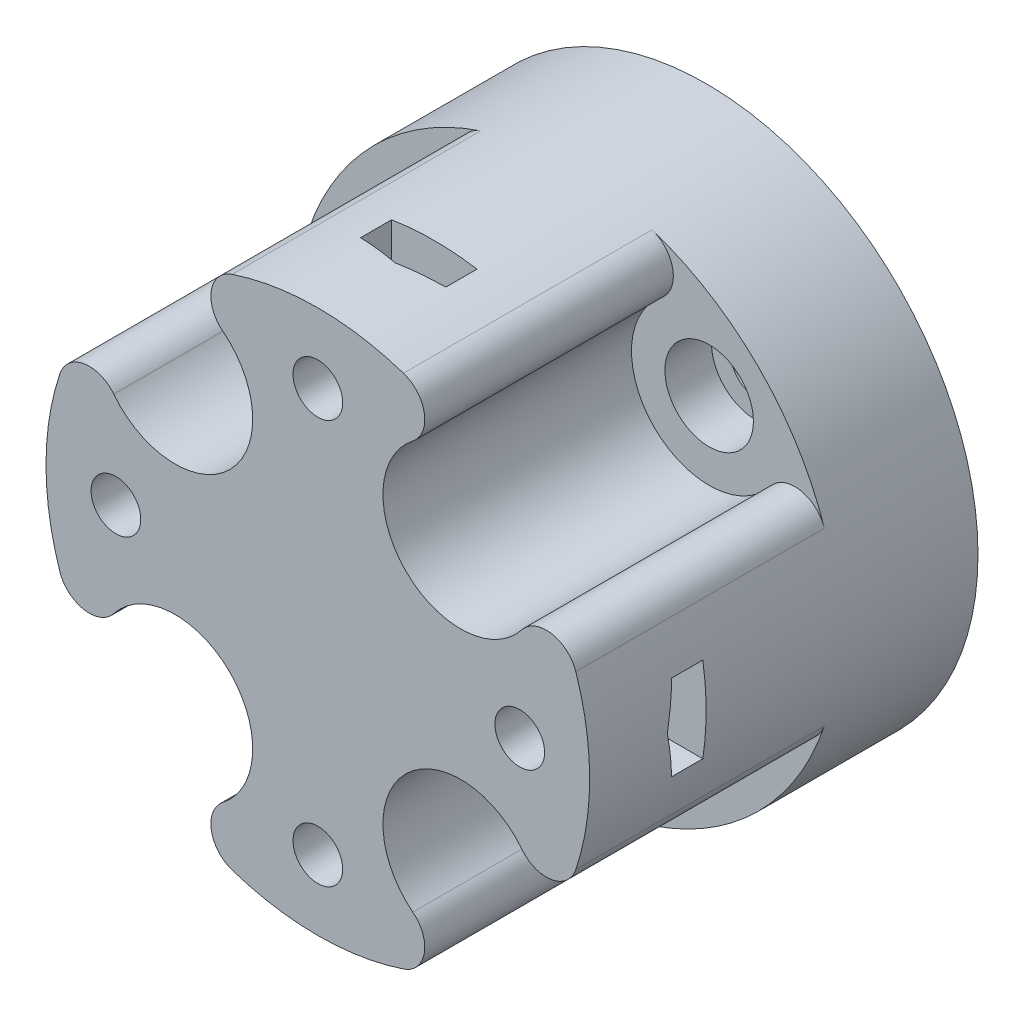
from build123d import *

# Parameters (mm, degrees)
SKETCH1_R           = 17.5
SKETCH1_R_2         = 2.85
BOSS_EXTRUDE1_DEPTH = 25
SKETCH1_3_R         = 2.85
SKETCH1_3_R_2       = 1.6
BOSS_EXTRUDE2_DEPTH = 6
SKETCH2_R           = 5
CUT_EXTRUDE1_DEPTH  = 16
FILLET1_R           = 2
CUT_EXTRUDE2_START  = -7.5
SKETCH3_R           = 1.6
CUT_EXTRUDE2_DEPTH  = 2.5
CUT_EXTRUDE3_START  = -10
SKETCH3_2_R         = 1.6
CUT_EXTRUDE3_DEPTH  = 10
CHAMFER1_SIZE       = 2.75
CHAMFER1_SIZE_2     = 0.5


with BuildPart() as part:
    # Sketch1 → Boss-Extrude1 (new body)
    with BuildSketch(Plane(origin=(0, 0, 0), x_dir=(0, 1, 0), z_dir=(0, 0, 1))):
        with Locations(Location((0, 0, 0), (0, 0, 270))):
            Circle(SKETCH1_R)
        with Locations(Location((-9.192388155, 9.192388155, 0), (0, 0, 270))):
            Circle(SKETCH1_R_2, mode=Mode.SUBTRACT)
        with Locations(Location((-9.192388155, -9.192388155, 0), (0, 0, 270))):
            Circle(SKETCH1_R_2, mode=Mode.SUBTRACT)
        with Locations(Location((9.192388155, -9.192388155, 0), (0, 0, 270))):
            Circle(SKETCH1_R_2, mode=Mode.SUBTRACT)
        with Locations(Location((9.192388155, 9.192388155, 0), (0, 0, 270))):
            Circle(SKETCH1_R_2, mode=Mode.SUBTRACT)
    extrude(amount=BOSS_EXTRUDE1_DEPTH)

    # Sketch1<3> → Boss-Extrude2 (add)
    # profile 1 of 4: a face of its own
    with BuildSketch(Plane(origin=(0, 0, 0), x_dir=(0, 1, 0), z_dir=(0, 0, 1))):
        with Locations(Location((-9.192388155, -9.192388155, 0), (0, 0, 270))):
            Circle(SKETCH1_3_R)
        with Locations(Location((-9.192388155, -9.192388155, 0), (0, 0, 270))):
            Circle(SKETCH1_3_R_2, mode=Mode.SUBTRACT)
    # profile 2 of 4: a face of its own
    with BuildSketch(Plane(origin=(0, 0, 0), x_dir=(0, 1, 0), z_dir=(0, 0, 1))):
        with Locations(Location((-9.192388155, 9.192388155, 0), (0, 0, 270))):
            Circle(SKETCH1_3_R)
        with Locations(Location((-9.192388155, 9.192388155, 0), (0, 0, 270))):
            Circle(SKETCH1_3_R_2, mode=Mode.SUBTRACT)
    # profile 3 of 4: a face of its own
    with BuildSketch(Plane(origin=(0, 0, 0), x_dir=(0, 1, 0), z_dir=(0, 0, 1))):
        with Locations(Location((9.192388155, -9.192388155, 0), (0, 0, 270))):
            Circle(SKETCH1_3_R)
        with Locations(Location((9.192388155, -9.192388155, 0), (0, 0, 270))):
            Circle(SKETCH1_3_R_2, mode=Mode.SUBTRACT)
    # profile 4 of 4: a face of its own
    with BuildSketch(Plane(origin=(0, 0, 0), x_dir=(0, 1, 0), z_dir=(0, 0, 1))):
        with Locations(Location((9.192388155, 9.192388155, 0), (0, 0, 270))):
            Circle(SKETCH1_3_R)
        with Locations(Location((9.192388155, 9.192388155, 0), (0, 0, 270))):
            Circle(SKETCH1_3_R_2, mode=Mode.SUBTRACT)
    extrude(amount=BOSS_EXTRUDE2_DEPTH)

    # Sketch2 → Cut-Extrude1 (cut)
    with BuildSketch(Plane.XY.offset(25)):
        with Locations((-9.192388155, 9.192388155)):
            Circle(SKETCH2_R)
        with Locations((9.192388155, 9.192388155)):
            Circle(SKETCH2_R)
        with Locations((9.192388155, -9.192388155)):
            Circle(SKETCH2_R)
        with Locations((-9.192388155, -9.192388155)):
            Circle(SKETCH2_R)
    extrude(amount=-CUT_EXTRUDE1_DEPTH, mode=Mode.SUBTRACT)

    # Fillet1
    fillet1_edges = [part.edges().sort_by_distance(p)[0] for p in [
        (-14.028560913, -10.46181049, 17),
        (-10.46181049, -14.028560913, 17),
        (10.46181049, -14.028560913, 17),
        (14.028560913, -10.46181049, 17),
        (14.028560913, 10.46181049, 17),
        (10.46181049, 14.028560913, 17),
        (-10.46181049, 14.028560913, 17),
        (-14.028560913, 10.46181049, 17),
    ]]
    fillet(fillet1_edges, radius=FILLET1_R)

    # Sketch3 → Cut-Extrude2 (cut)
    # profile 1 of 4: a face of its own
    with BuildSketch(Plane.XY.offset(25).offset(CUT_EXTRUDE2_START)):
        with BuildLine():
            Line((-2.75, 15.75), (-2.75, 17.282577933))
            ThreePointArc((-2.75, 17.282577933), (0, 17.5), (2.75, 17.282577933))
            Line((2.75, 17.282577933), (2.75, 15.75))
            Line((2.75, 15.75), (2.75, 10.25))
            Line((2.75, 10.25), (-2.75, 10.25))
            Line((-2.75, 10.25), (-2.75, 15.75))
        make_face()
        with Locations((0, 13)):
            Circle(SKETCH3_R, mode=Mode.SUBTRACT)
    # profile 2 of 4: a face of its own
    with BuildSketch(Plane.XY.offset(25).offset(CUT_EXTRUDE2_START)):
        with BuildLine():
            Line((15.75, -2.75), (10.25, -2.75))
            Line((10.25, -2.75), (10.25, 2.75))
            Line((10.25, 2.75), (15.75, 2.75))
            Line((15.75, 2.75), (17.282577933, 2.75))
            ThreePointArc((17.282577933, 2.75), (17.5, 0), (17.282577933, -2.75))
            Line((17.282577933, -2.75), (15.75, -2.75))
        make_face()
        with Locations((13, 0)):
            Circle(SKETCH3_R, mode=Mode.SUBTRACT)
    # profile 3 of 4: a face of its own
    with BuildSketch(Plane.XY.offset(25).offset(CUT_EXTRUDE2_START)):
        with BuildLine():
            Line((-2.75, -15.75), (-2.75, -10.25))
            Line((-2.75, -10.25), (2.75, -10.25))
            Line((2.75, -10.25), (2.75, -15.75))
            Line((2.75, -15.75), (2.75, -17.282577933))
            ThreePointArc((2.75, -17.282577933), (0, -17.5), (-2.75, -17.282577933))
            Line((-2.75, -17.282577933), (-2.75, -15.75))
        make_face()
        with Locations((0, -13)):
            Circle(SKETCH3_R, mode=Mode.SUBTRACT)
    # profile 4 of 4: a face of its own
    with BuildSketch(Plane.XY.offset(25).offset(CUT_EXTRUDE2_START)):
        with BuildLine():
            Line((-15.75, 2.75), (-10.25, 2.75))
            Line((-10.25, 2.75), (-10.25, -2.75))
            Line((-10.25, -2.75), (-15.75, -2.75))
            Line((-15.75, -2.75), (-17.282577933, -2.75))
            ThreePointArc((-17.282577933, -2.75), (-17.5, 0), (-17.282577933, 2.75))
            Line((-17.282577933, 2.75), (-15.75, 2.75))
        make_face()
        with Locations((-13, 0)):
            Circle(SKETCH3_R, mode=Mode.SUBTRACT)
    extrude(amount=CUT_EXTRUDE2_DEPTH, mode=Mode.SUBTRACT)

    # Sketch3<2> → Cut-Extrude3 (cut)
    with BuildSketch(Plane.XY.offset(25).offset(CUT_EXTRUDE3_START)):
        with Locations((-13, 0)):
            Circle(SKETCH3_2_R)
        with Locations((0, 13)):
            Circle(SKETCH3_2_R)
        with Locations((13, 0)):
            Circle(SKETCH3_2_R)
        with Locations((0, -13)):
            Circle(SKETCH3_2_R)
    extrude(amount=CUT_EXTRUDE3_DEPTH, mode=Mode.SUBTRACT)

    # Chamfer1
    # the kernel refuses this chamfer: 2.75, 0.5 mm, written as the material it adds along each edge
    with BuildSketch(Plane(origin=(-3.104266441, -2.75, 20), x_dir=(1.0355932807417332e-14, 0.9999763028084744, 0.006884317068104265), z_dir=(-1, 0, 0))) as chamfer1_piece_1_section:
        Polygon((CHAMFER1_SIZE * 0.999976302808, CHAMFER1_SIZE * 0.0068843170681), (-CHAMFER1_SIZE_2 * 0.0068843170681, CHAMFER1_SIZE_2 * 0.999976302808), (0, 0), align=None)
    chamfer1_piece_1 = extrude(amount=21.324045051, mode=Mode.PRIVATE)
    chamfer1_piece_1 = chamfer1_piece_1 & Plane(origin=(0, 0, 19.863927103), x_dir=(1, 0, 0), z_dir=(0, 0, -1)) * Cylinder(17.5, 54, mode=Mode.PRIVATE)
    chamfer1_piece_1 = chamfer1_piece_1 - Plane(origin=(-13, 0, 19.863927103), x_dir=(1, 0, 0), z_dir=(0, 0, -1)) * Cylinder(1.6, 54, mode=Mode.PRIVATE)
    add(chamfer1_piece_1)
    with BuildSketch(Plane(origin=(-24.428311492, 2.75, 20), x_dir=(2.1371797081769355e-15, 0.20388124945923355, -0.9789956262001082), z_dir=(1, 0, 0))) as chamfer1_piece_2_section:
        Polygon((CHAMFER1_SIZE_2 * 0.9789956262, -CHAMFER1_SIZE_2 * 0.203881249459), (-CHAMFER1_SIZE * 0.203881249459, -CHAMFER1_SIZE * 0.9789956262), (0, 0), align=None)
    chamfer1_piece_2 = extrude(amount=21.324045051, mode=Mode.PRIVATE)
    chamfer1_piece_2 = chamfer1_piece_2 & Plane(origin=(0, 0, 19.852070676), x_dir=(1, 0, 0), z_dir=(0, 0, -1)) * Cylinder(17.5, 54, mode=Mode.PRIVATE)
    chamfer1_piece_2 = chamfer1_piece_2 - Plane(origin=(-13, 0, 19.852070676), x_dir=(1, 0, 0), z_dir=(0, 0, -1)) * Cylinder(1.6, 54, mode=Mode.PRIVATE)
    add(chamfer1_piece_2)
    with BuildSketch(Plane(origin=(-2.75, 3.104266441, 20), x_dir=(0.9999763028084744, 0, 0.006884317068104265), z_dir=(0, 1, 0))) as chamfer1_piece_3_section:
        Polygon((CHAMFER1_SIZE * 0.999976302808, CHAMFER1_SIZE * 0.0068843170681), (-CHAMFER1_SIZE_2 * 0.0068843170681, CHAMFER1_SIZE_2 * 0.999976302808), (0, 0), align=None)
    chamfer1_piece_3 = extrude(amount=21.324045051, mode=Mode.PRIVATE)
    chamfer1_piece_3 = chamfer1_piece_3 & Plane(origin=(0, 0, 19.863927103), x_dir=(1, 0, 0), z_dir=(0, 0, -1)) * Cylinder(17.5, 54, mode=Mode.PRIVATE)
    chamfer1_piece_3 = chamfer1_piece_3 - Plane(origin=(0, 13, 19.863927103), x_dir=(1, 0, 0), z_dir=(0, 0, -1)) * Cylinder(1.6, 54, mode=Mode.PRIVATE)
    add(chamfer1_piece_3)
    with BuildSketch(Plane(origin=(2.75, 24.428311492, 20), x_dir=(0.20388124945923355, 0, -0.9789956262001082), z_dir=(0, -1, 0))) as chamfer1_piece_4_section:
        Polygon((CHAMFER1_SIZE_2 * 0.9789956262, -CHAMFER1_SIZE_2 * 0.203881249459), (-CHAMFER1_SIZE * 0.203881249459, -CHAMFER1_SIZE * 0.9789956262), (0, 0), align=None)
    chamfer1_piece_4 = extrude(amount=21.324045051, mode=Mode.PRIVATE)
    chamfer1_piece_4 = chamfer1_piece_4 & Plane(origin=(0, 0, 19.852070749), x_dir=(1, 0, 0), z_dir=(0, 0, -1)) * Cylinder(17.5, 54, mode=Mode.PRIVATE)
    chamfer1_piece_4 = chamfer1_piece_4 - Plane(origin=(0, 13, 19.852070749), x_dir=(1, 0, 0), z_dir=(0, 0, -1)) * Cylinder(1.6, 54, mode=Mode.PRIVATE)
    add(chamfer1_piece_4)
    with BuildSketch(Plane(origin=(3.104266441, 2.75, 20), x_dir=(-3.409880314637416e-15, -0.9999763028084744, 0.006884317068104265), z_dir=(1, 0, 0))) as chamfer1_piece_5_section:
        Polygon((CHAMFER1_SIZE * 0.999976302808, CHAMFER1_SIZE * 0.0068843170681), (-CHAMFER1_SIZE_2 * 0.0068843170681, CHAMFER1_SIZE_2 * 0.999976302808), (0, 0), align=None)
    chamfer1_piece_5 = extrude(amount=21.324045051, mode=Mode.PRIVATE)
    chamfer1_piece_5 = chamfer1_piece_5 & Plane(origin=(0, 0, 19.863927103), x_dir=(1, 0, 0), z_dir=(0, 0, -1)) * Cylinder(17.5, 54, mode=Mode.PRIVATE)
    chamfer1_piece_5 = chamfer1_piece_5 - Plane(origin=(13, 0, 19.863927103), x_dir=(1, 0, 0), z_dir=(0, 0, -1)) * Cylinder(1.6, 54, mode=Mode.PRIVATE)
    add(chamfer1_piece_5)
    with BuildSketch(Plane(origin=(24.428311492, -2.75, 20), x_dir=(3.409880314637416e-15, 0.9999763028084744, 0.006884317068104265), z_dir=(-1, 0, 0))) as chamfer1_piece_6_section:
        Polygon((CHAMFER1_SIZE * 0.999976302808, CHAMFER1_SIZE * 0.0068843170681), (-CHAMFER1_SIZE_2 * 0.0068843170681, CHAMFER1_SIZE_2 * 0.999976302808), (0, 0), align=None)
    chamfer1_piece_6 = extrude(amount=21.324045051, mode=Mode.PRIVATE)
    chamfer1_piece_6 = chamfer1_piece_6 & Plane(origin=(0, 0, 19.852070366), x_dir=(1, 0, 0), z_dir=(0, 0, -1)) * Cylinder(17.5, 54, mode=Mode.PRIVATE)
    chamfer1_piece_6 = chamfer1_piece_6 - Plane(origin=(13, 0, 19.852070366), x_dir=(1, 0, 0), z_dir=(0, 0, -1)) * Cylinder(1.6, 54, mode=Mode.PRIVATE)
    add(chamfer1_piece_6)
    with BuildSketch(Plane(origin=(2.75, -3.104266441, 20), x_dir=(-0.9999763028084744, 6.88290656102737e-15, 0.006884317068104265), z_dir=(0, -1, 0))) as chamfer1_piece_7_section:
        Polygon((CHAMFER1_SIZE * 0.999976302808, CHAMFER1_SIZE * 0.0068843170681), (-CHAMFER1_SIZE_2 * 0.0068843170681, CHAMFER1_SIZE_2 * 0.999976302808), (0, 0), align=None)
    chamfer1_piece_7 = extrude(amount=21.324045051, mode=Mode.PRIVATE)
    chamfer1_piece_7 = chamfer1_piece_7 & Plane(origin=(0, 0, 19.863927103), x_dir=(1, 0, 0), z_dir=(0, 0, -1)) * Cylinder(17.5, 54, mode=Mode.PRIVATE)
    chamfer1_piece_7 = chamfer1_piece_7 - Plane(origin=(0, -13, 19.863927103), x_dir=(1, 0, 0), z_dir=(0, 0, -1)) * Cylinder(1.6, 54, mode=Mode.PRIVATE)
    add(chamfer1_piece_7)
    with BuildSketch(Plane(origin=(-2.75, -24.428311492, 20), x_dir=(-0.20388124945923355, 1.4290779976363847e-15, -0.9789956262001082), z_dir=(0, 1, 0))) as chamfer1_piece_8_section:
        Polygon((CHAMFER1_SIZE_2 * 0.9789956262, -CHAMFER1_SIZE_2 * 0.203881249459), (-CHAMFER1_SIZE * 0.203881249459, -CHAMFER1_SIZE * 0.9789956262), (0, 0), align=None)
    chamfer1_piece_8 = extrude(amount=21.324045051, mode=Mode.PRIVATE)
    chamfer1_piece_8 = chamfer1_piece_8 & Plane(origin=(0, 0, 19.852070422), x_dir=(1, 0, 0), z_dir=(0, 0, -1)) * Cylinder(17.5, 54, mode=Mode.PRIVATE)
    chamfer1_piece_8 = chamfer1_piece_8 - Plane(origin=(0, -13, 19.852070422), x_dir=(1, 0, 0), z_dir=(0, 0, -1)) * Cylinder(1.6, 54, mode=Mode.PRIVATE)
    add(chamfer1_piece_8)


solid = part.part
